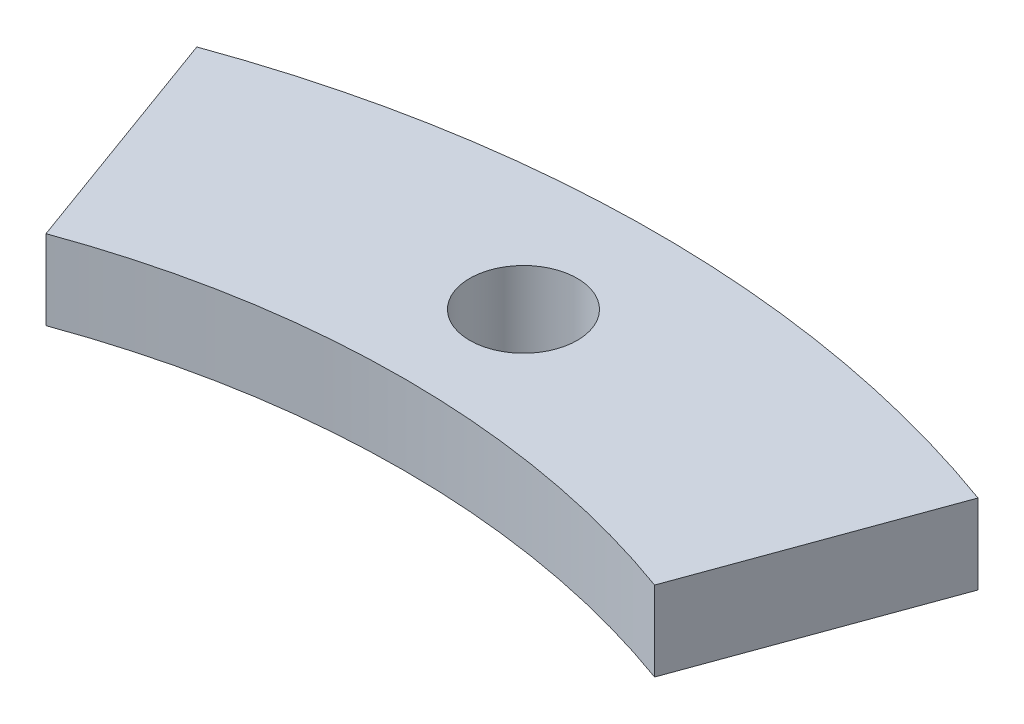
from build123d import *

# Parameters (mm, degrees)
SKETCH1_R               = 43
SKETCH1_R_2             = 33.5
BOSS_EXTRUDE1_DEPTH     = 3
CUT_EXTRUDE1_DEPTH      = 61.88513776
CUT_EXTRUDE2_DEPTH      = 46.544394961
CUT_EXTRUDE2_DEPTH_BACK = 46.544394961
SKETCH3_R               = 2.025


with BuildPart() as part:
    # Sketch1 → Boss-Extrude1 (new body)
    with BuildSketch(Plane(origin=(0, 0, 0), x_dir=(1, 0, 0), z_dir=(0, 1, 0))):
        Circle(SKETCH1_R)
        Circle(SKETCH1_R_2, mode=Mode.SUBTRACT)
    extrude(amount=BOSS_EXTRUDE1_DEPTH)

    # Sketch2 → Cut-Extrude1 (cut, symmetric)
    with BuildSketch(Plane(origin=(0, 3, 0), x_dir=(1, 0, 0), z_dir=(0, 1, 0))):
        with BuildLine():
            Line((0, 0), (0, -52.31984462))
            ThreePointArc((0, -52.31984462), (51.524988618, -9.085245674), (17.894440756, 49.16457191))
            Line((17.894440756, 49.16457191), (0, 0))
        make_face()
    cut_extrude1 = extrude(amount=CUT_EXTRUDE1_DEPTH, both=True, mode=Mode.SUBTRACT)

    # Mirror1: Cut-Extrude1 across plane
    add(cut_extrude1.mirror(Plane(origin=(0, 0, 0), x_dir=(0, 0, 1), z_dir=(1, 0, 0))), mode=Mode.SUBTRACT)

    # Sketch3 → Cut-Extrude2 (cut, two sides: drawn at the far end of the back side and taken through both)
    with BuildSketch(Plane(origin=(0, 3, 0), x_dir=(1, 0, 0), z_dir=(0, 1, 0)).offset(-CUT_EXTRUDE2_DEPTH_BACK)):
        with Locations((0, 38)):
            Circle(SKETCH3_R)
    extrude(amount=CUT_EXTRUDE2_DEPTH + CUT_EXTRUDE2_DEPTH_BACK, mode=Mode.SUBTRACT)


solid = part.part
